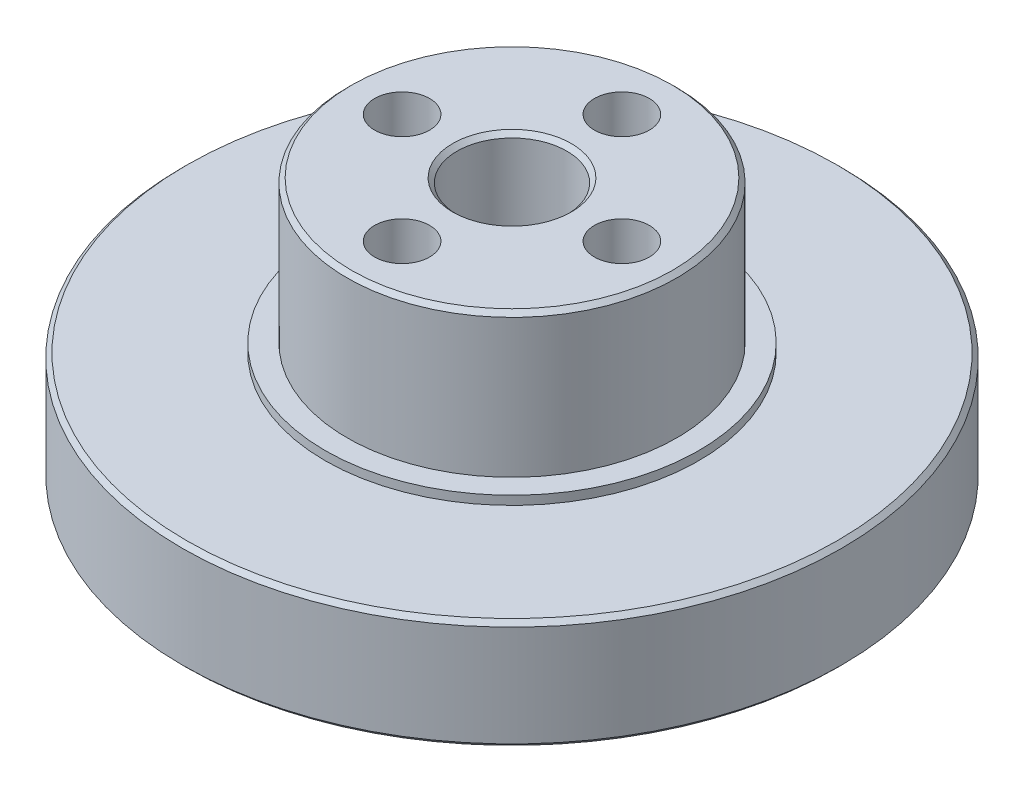
from build123d import *

# Parameters (mm, degrees)
SKETCH_1_R          = 15
SKETCH_1_R_2        = 1.83
EXTRUDE_1_DEPTH     = 3.4
SKETCH_2_R          = 15
EXTRUDE_2_DEPTH     = 1.6
SKETCH_3_R          = 8.5
EXTRUDE_3_DEPTH     = 0.4
SKETCH_4_R          = 7.5
EXTRUDE_4_DEPTH     = 6.5
SKETCH_5_R          = 1.25
SKETCH_5_R_2        = 2.5
CUT_EXTRUDE_1_DEPTH = 5
CHAMFER_1_SIZE      = 0.2
SKETCH_7_R          = 2.5
CUT_EXTRUDE_4_DEPTH = 23.307173734
SKETCH_8_R          = 6
CUT_EXTRUDE_5_DEPTH = 2
CHAMFER_2_SIZE      = 0.5


with BuildPart() as part:
    # 草图1 → 凸台-拉伸1 (new body)
    with BuildSketch(Plane(origin=(0, 0, 0), x_dir=(1, 0, 0), z_dir=(0, 1, 0))):
        Circle(SKETCH_1_R)
        with Locations((0, 11.525)):
            Circle(SKETCH_1_R_2, mode=Mode.SUBTRACT)
        with Locations((9.980942779, 5.7625)):
            Circle(SKETCH_1_R_2, mode=Mode.SUBTRACT)
        with Locations((9.980942779, -5.7625)):
            Circle(SKETCH_1_R_2, mode=Mode.SUBTRACT)
        with Locations((0, -11.525)):
            Circle(SKETCH_1_R_2, mode=Mode.SUBTRACT)
        with Locations((-9.980942779, -5.7625)):
            Circle(SKETCH_1_R_2, mode=Mode.SUBTRACT)
        with Locations((-9.980942779, 5.7625)):
            Circle(SKETCH_1_R_2, mode=Mode.SUBTRACT)
    extrude(amount=EXTRUDE_1_DEPTH)

    # 草图2 → 凸台-拉伸2 (add)
    with BuildSketch(Plane(origin=(0, 3.4, 0), x_dir=(1, 0, 0), z_dir=(0, 1, 0))):
        Circle(SKETCH_2_R)
    extrude(amount=EXTRUDE_2_DEPTH)

    # 草图3 → 凸台-拉伸3 (add)
    with BuildSketch(Plane(origin=(0, 5, 0), x_dir=(1, 0, 0), z_dir=(0, 1, 0))):
        Circle(SKETCH_3_R)
    extrude(amount=EXTRUDE_3_DEPTH)

    # 草图4 → 凸台-拉伸4 (add)
    with BuildSketch(Plane(origin=(0, 5.4, 0), x_dir=(1, 0, 0), z_dir=(0, 1, 0))):
        Circle(SKETCH_4_R)
    extrude(amount=EXTRUDE_4_DEPTH)

    # 草图5 → 切除-拉伸1 (cut)
    with BuildSketch(Plane(origin=(0, 11.9, 0), x_dir=(1, 0, 0), z_dir=(0, 1, 0))):
        with Locations((0, 5)):
            Circle(SKETCH_5_R)
        with Locations((5, 0)):
            Circle(SKETCH_5_R)
        with Locations((0, -5)):
            Circle(SKETCH_5_R)
        with Locations((-5, 0)):
            Circle(SKETCH_5_R)
        Circle(SKETCH_5_R_2)
    extrude(amount=-CUT_EXTRUDE_1_DEPTH, mode=Mode.SUBTRACT)

    # 倒角1
    chamfer_1_edges = [part.edges().sort_by_distance(p)[0] for p in [
        (-11.810942779, 0, -5.7625),
        (-11.810942779, 0, 5.7625),
        (-1.83, 0, 11.525),
        (8.150942779, 0, 5.7625),
        (8.150942779, 0, -5.7625),
        (-1.83, 0, -11.525),
        (-15, 0, 0),
        (-7.5, 11.9, 0),
        (-15, 5, 0),
        (-2.5, 11.9, 0),
    ]]
    chamfer(chamfer_1_edges, length=CHAMFER_1_SIZE)

    # 草图7 → 切除-拉伸4 (cut, through all)
    with BuildSketch(Plane(origin=(0, 6.9, 0), x_dir=(1, 0, 0), z_dir=(0, 1, 0))):
        Circle(SKETCH_7_R)
    extrude(amount=-CUT_EXTRUDE_4_DEPTH, mode=Mode.SUBTRACT)

    # 草图8 → 切除-拉伸5 (cut)
    with BuildSketch(Plane(origin=(0, 0, 0), x_dir=(-1, 0, 0), z_dir=(0, -1, 0))):
        Circle(SKETCH_8_R)
    extrude(amount=-CUT_EXTRUDE_5_DEPTH, mode=Mode.SUBTRACT)

    # 倒角2
    chamfer_2_edges = [part.edges().sort_by_distance(p)[0] for p in [
        (6, 0, 0),
        (-2.5, 2, 0),
        (6, 2, 0),
    ]]
    chamfer(chamfer_2_edges, length=CHAMFER_2_SIZE)


solid = part.part
